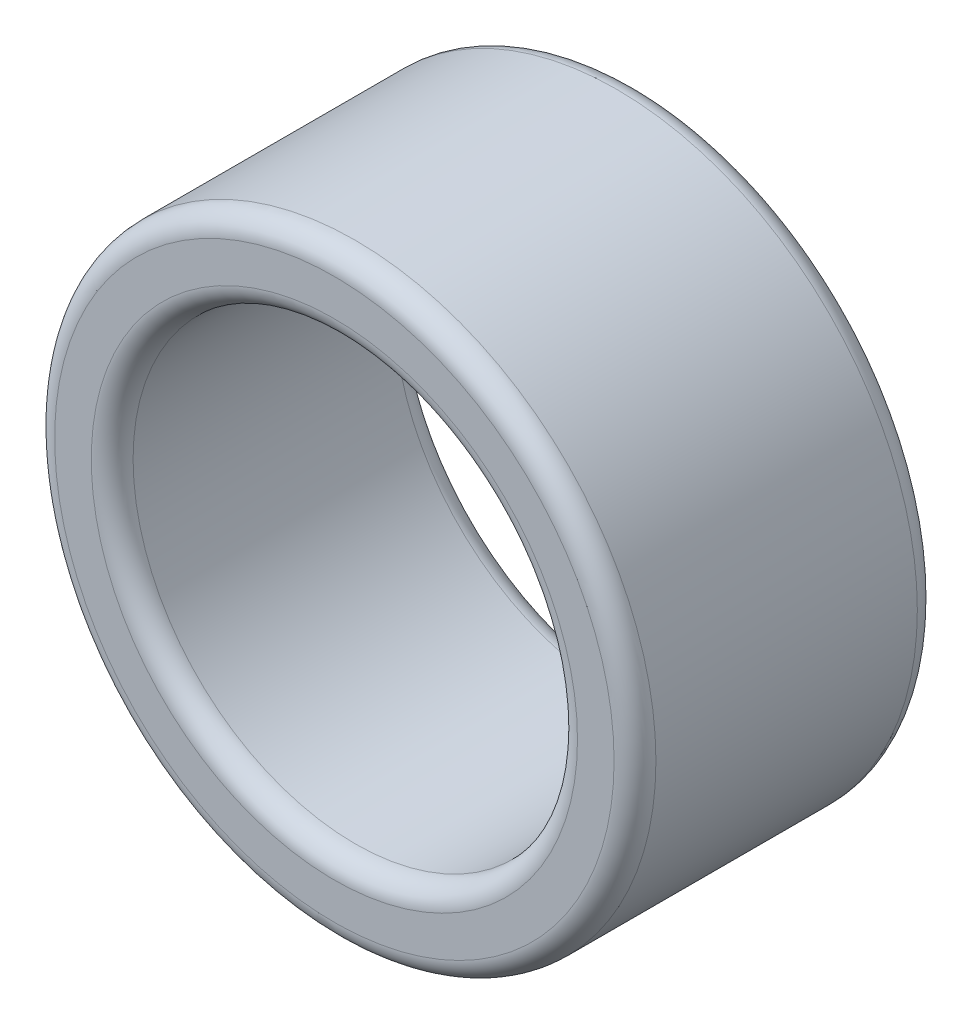
from build123d import *

# Parameters (mm, degrees)
SKETCH_1_R        = 57.5
SKETCH_1_R_2      = 42.5
EXTRUDE_317_DEPTH = 29
FILLET_1_R        = 4


with BuildPart() as part:
    # Эскиз1 → Extrude 317 (new, symmetric)
    with BuildSketch(Plane.XY):
        Circle(SKETCH_1_R)
        Circle(SKETCH_1_R_2, mode=Mode.SUBTRACT)
    extrude(amount=EXTRUDE_317_DEPTH, both=True)

    # Скругление1
    fillet_1_edges = [part.edges().sort_by_distance(p)[0] for p in [
        (-42.5, 0, 29),
        (-57.5, 0, 29),
        (-42.5, 0, -29),
        (-57.5, 0, -29),
    ]]
    fillet(fillet_1_edges, radius=FILLET_1_R)


solid = part.part
